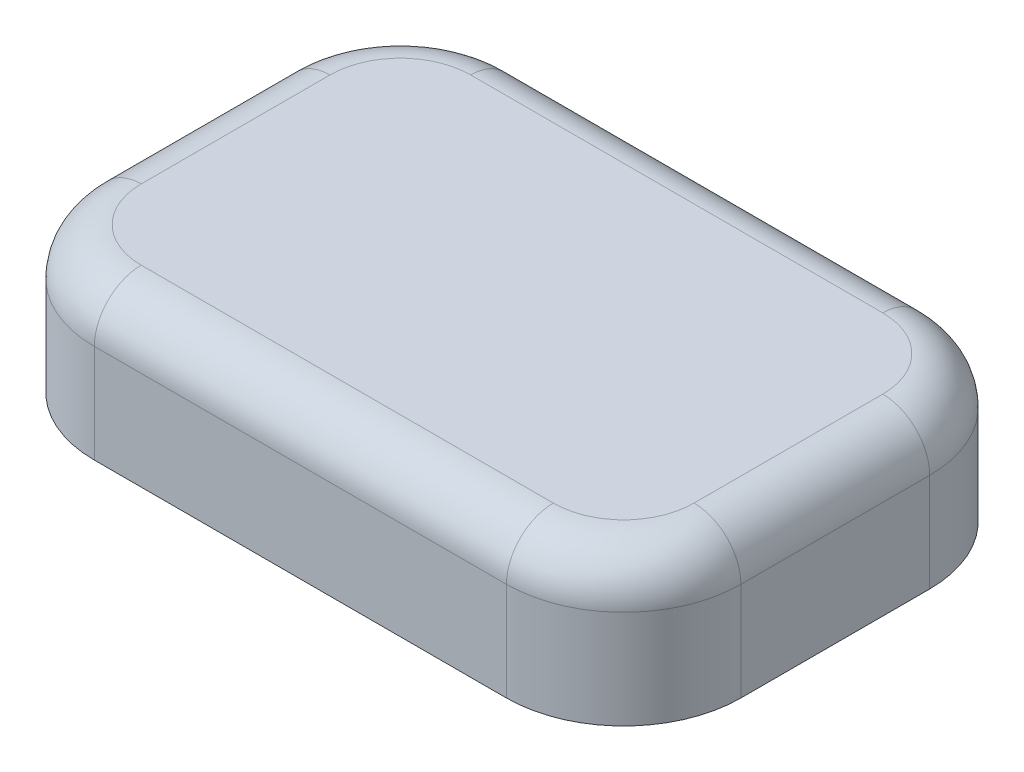
from build123d import *

# Parameters (mm, degrees)
SKETCH_1_R      = 2.8
EXTRUDE_1_DEPTH = 5
SKETCH_2_W      = 27.575
SKETCH_2_H      = 18.05
EXTRUDE_2_DEPTH = 1.2
SKETCH_3_W      = 27.575
SKETCH_3_H      = 18.05
SKETCH_3_W_2    = 25.175
SKETCH_3_H_2    = 15.65
EXTRUDE_3_DEPTH = 5
FILLET_1_R      = 5
FILLET_2_R      = 2
CHAMFER_1_SIZE  = 0.5


with BuildPart() as part:
    # 草图1 → 凸台-拉伸1 (new body)
    with BuildSketch(Plane(origin=(0, 0, 0), x_dir=(1, 0, 0), z_dir=(0, 1, 0))):
        Circle(SKETCH_1_R)
        Polygon((2.2, 0.6), (2.2, -0.6), (0.6, -0.6), (0.6, -2.2), (-0.6, -2.2), (-0.6, -0.6), (-2.2, -0.6), (-2.2, 0.6), (-0.6, 0.6), (-0.6, 2.2), (0.6, 2.2), (0.6, 0.6), align=None, mode=Mode.SUBTRACT)
    extrude(amount=-EXTRUDE_1_DEPTH)

    # 草图2 → 凸台-拉伸2 (add)
    with BuildSketch(Plane(origin=(0, 0, 0), x_dir=(1, 0, 0), z_dir=(0, 1, 0))):
        Rectangle(SKETCH_2_W, SKETCH_2_H)
    extrude(amount=EXTRUDE_2_DEPTH)

    # 草图3 → 凸台-拉伸3 (add)
    with BuildSketch(Plane(origin=(0, 0, 0), x_dir=(1, 0, 0), z_dir=(0, 1, 0))):
        Rectangle(SKETCH_3_W, SKETCH_3_H)
        Rectangle(SKETCH_3_W_2, SKETCH_3_H_2, mode=Mode.SUBTRACT)
    extrude(amount=-EXTRUDE_3_DEPTH)

    # 圆角1
    fillet_1_edges = [part.edges().sort_by_distance(p)[0] for p in [
        (13.7875, -1.9, -9.025),
        (13.7875, -1.9, 9.025),
        (-13.7875, -1.9, 9.025),
        (-13.7875, -1.9, -9.025),
        (-12.5875, -2.5, -7.825),
        (12.5875, -2.5, -7.825),
        (12.5875, -2.5, 7.825),
        (-12.5875, -2.5, 7.825),
    ]]
    fillet(fillet_1_edges, radius=FILLET_1_R)

    # 圆角2
    fillet_2_edges = [part.edges().sort_by_distance(p)[0] for p in [
        (12.5875, 0, 0),
        (0, 0, 7.825),
        (-12.5875, 0, 0),
        (0, 0, -7.825),
        (12.323033906, 1.2, 7.560533906),
        (0, 1.2, 9.025),
        (-12.323033906, 1.2, 7.560533906),
        (-13.7875, 1.2, 0),
        (-12.323033906, 1.2, -7.560533906),
        (0, 1.2, -9.025),
        (12.323033906, 1.2, -7.560533906),
        (13.7875, 1.2, 0),
        (11.123033906, 0, 6.360533906),
        (-11.123033906, 0, 6.360533906),
        (-11.123033906, 0, -6.360533906),
        (11.123033906, 0, -6.360533906),
    ]]
    fillet(fillet_2_edges, radius=FILLET_2_R)

    # 倒角1
    chamfer_1_edges = [part.edges().sort_by_distance(p)[0] for p in [
        (-2.8, 0, 0),
    ]]
    chamfer(chamfer_1_edges, length=CHAMFER_1_SIZE)


solid = part.part
